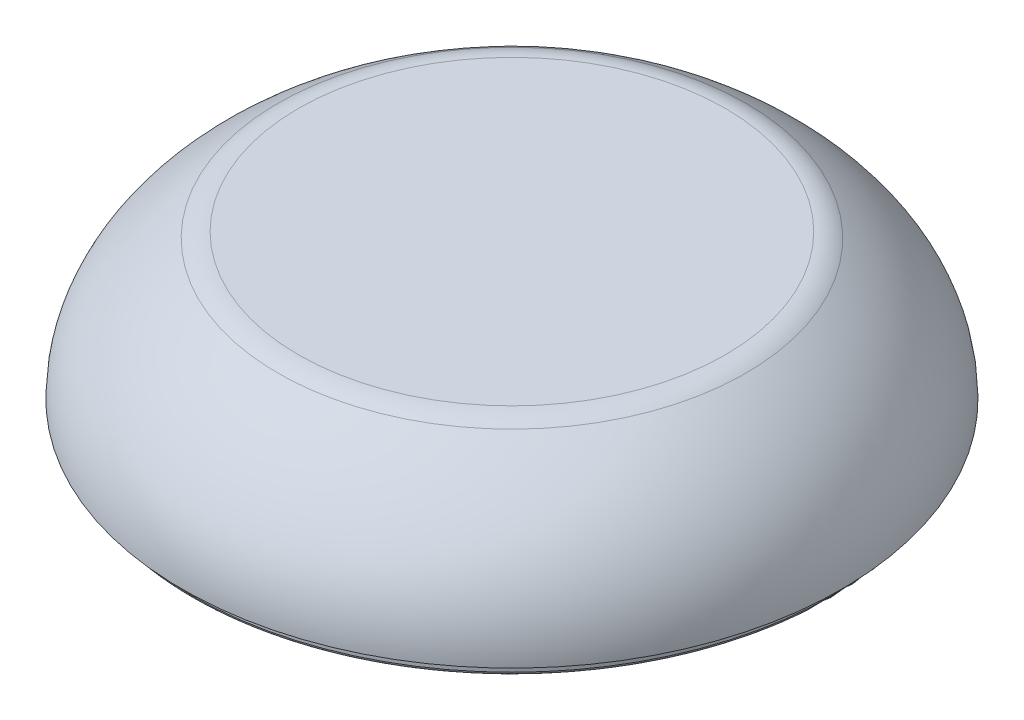
from build123d import *

# Parameters (mm, degrees)
CASCA1_T                             = -2
RESSALTO_EXTRUS_O1_REACH             = 76.054
ESBO_O4_R                            = 48.5
ESBO_O4_R_2                          = 47
RESSALTO_EXTRUS_O1_DIRECTION_2_DEPTH = 2
FILETE1_R                            = 10
FILETE2_R                            = 0.4
FILETE4_R                            = 6


with BuildPart() as part:
    # Esboço3 → Revolução2 (revolve)
    with BuildSketch(Plane.XY):
        with BuildLine():
            Line((0, 0), (0, 22))
            Line((0, 22), (33.993463424, 22))
            add(Edge.make_bspline(
                [(50, 0), (50, 13.096257199), (33.993463424, 22)],
                knots=[3.141592654, 3.141592654, 3.141592654, 3.964804631, 3.964804631, 3.964804631], degree=2, weights=[1, 0.916479478, 1]))
            Line((50, 0), (0, 0))
        make_face()
    revolve(axis=Axis((0, 0, 0), (0, 1, 0)))

    # Casca1
    casca1_openings = [part.faces().sort_by_distance(p)[0] for p in [
        (0, 0, 0),
    ]]
    offset(amount=CASCA1_T, openings=casca1_openings, kind=Kind.INTERSECTION)

    # Esboço4 → Ressalto-extrusão1 (add, up to next)
    with BuildSketch(Plane.XZ, mode=Mode.PRIVATE) as ressalto_extrus_o1_sk1:
        Circle(ESBO_O4_R)
        Circle(ESBO_O4_R_2, mode=Mode.SUBTRACT)
    ressalto_extrus_o1_tool1 = extrude(ressalto_extrus_o1_sk1.sketch, amount=-RESSALTO_EXTRUS_O1_REACH, mode=Mode.PRIVATE) - part.part
    add(ressalto_extrus_o1_tool1.solids().sort_by_distance((-47.128213, 0, 0))[0])

    # Esboço4 → Ressalto-extrusão1 direction 2 (add)
    with BuildSketch(Plane.XZ):
        Circle(ESBO_O4_R)
        Circle(ESBO_O4_R_2, mode=Mode.SUBTRACT)
    extrude(amount=RESSALTO_EXTRUS_O1_DIRECTION_2_DEPTH)

    # Filete1
    filete1_edges = [part.edges().sort_by_distance(p)[0] for p in [
        (-46.999999993, 5.631751342, -1e-09),
    ]]
    fillet(filete1_edges, radius=FILETE1_R)

    # Filete2
    filete2_edges = [part.edges().sort_by_distance(p)[0] for p in [
        (-48.5, -2, 0),
    ]]
    fillet(filete2_edges, radius=FILETE2_R)

    # Filete4
    filete4_edges = [part.edges().sort_by_distance(p)[0] for p in [
        (-33.993463424, 22, 0),
    ]]
    fillet(filete4_edges, radius=FILETE4_R)


solid = part.part
